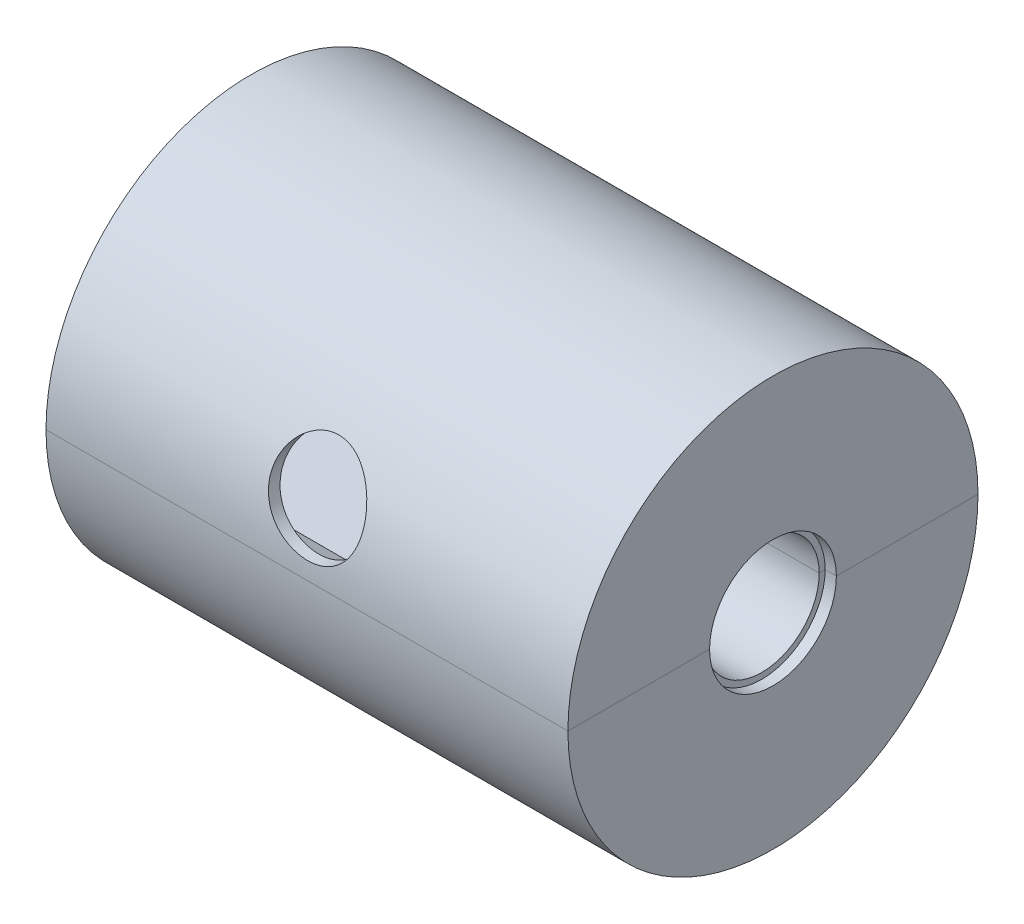
from build123d import *

# Parameters (mm, degrees)
SKETCH1_R           = 27.5
BOSS_EXTRUDE1_DEPTH = 70
SHELL1_T            = -1.5
SHELL2_T            = -1.5
SKETCH2_R           = 8.5
CUT_EXTRUDE1_DEPTH  = 81.07808689
BOSS_EXTRUDE2_DEPTH = 10
SKETCH5_W           = 45
SKETCH5_H           = 45
BOSS_EXTRUDE3_DEPTH = 1.6
MIRROR6_START       = -68.5
MIRROR6_DEPTH       = 10
MIRROR6_START_2     = -11.5
MIRROR6_2_DEPTH     = 10
SKETCH6_R           = 2
CUT_EXTRUDE2_DEPTH  = 8
SKETCH7_R           = 3
CUT_EXTRUDE3_DEPTH  = 81.07808689
SKETCH8_R           = 3
SKETCH8_R_2         = 2.3
BOSS_EXTRUDE4_DEPTH = 3
SKETCH9_R           = 6.25
CUT_EXTRUDE4_DEPTH  = 81.078087046


with BuildPart() as part:
    # Sketch1 → Boss-Extrude1 (new body)
    with BuildSketch(Plane(origin=(0, 0, 0), x_dir=(0, 0, -1), z_dir=(1, 0, 0))):
        Circle(SKETCH1_R)
    extrude(amount=-BOSS_EXTRUDE1_DEPTH)


with BuildPart() as body_2:
    # Split1: the piece on the far side of the plane
    add(part.part)
    split(bisect_by=Plane.ZX, keep=Keep.BOTTOM)

    # Shell1
    shell1_openings = [body_2.faces().sort_by_distance(p)[0] for p in [
        (-35, 0, 0),
    ]]
    offset(amount=SHELL1_T, openings=shell1_openings)


with BuildPart() as part_1:
    add(part.part)

    # Split1
    split(bisect_by=Plane.ZX, keep=Keep.TOP)

    # Shell2
    shell2_openings = [part_1.faces().sort_by_distance(p)[0] for p in [
        (-35, 0, 0),
    ]]
    offset(amount=SHELL2_T, openings=shell2_openings)


with BuildPart() as cut_extrude1_tool:
    # Sketch2 → Cut-Extrude1 (new, through all)
    with BuildSketch(Plane.ZY.offset(70)):
        Circle(SKETCH2_R)
    extrude(amount=-CUT_EXTRUDE1_DEPTH)


with BuildPart() as part_2:
    add(part_1.part)

    # Cut-Extrude1: cut by cut_extrude1_tool
    add(cut_extrude1_tool.part, mode=Mode.SUBTRACT)

    # Mirror6: read off the stored shape, not the designer's step
    # Mirror6 outline → Mirror6 (add)
    with BuildSketch(Plane.YZ.offset(MIRROR6_START)):
        with BuildLine():
            Line((0, -7.7), (0, -26))
            ThreePointArc((0, -26), (26, 0), (0, 26))
            Line((0, 26), (0, 7.7))
            ThreePointArc((0, 7.7), (7.7, 0), (0, -7.7))
        make_face()
    extrude(amount=MIRROR6_DEPTH)

    # Mirror6 2 outline → Mirror6 2 (add)
    with BuildSketch(Plane.YZ.offset(MIRROR6_START_2)):
        with BuildLine():
            Line((0, -7.7), (0, -26))
            ThreePointArc((0, -26), (26, 0), (0, 26))
            Line((0, 26), (0, 7.7))
            ThreePointArc((0, 7.7), (7.7, 0), (0, -7.7))
        make_face()
    extrude(amount=MIRROR6_2_DEPTH)

    # Sketch6 → Cut-Extrude2 (cut)
    with BuildSketch(Plane(origin=(0, 0, 0), x_dir=(1, 0, 0), z_dir=(0, 1, 0))):
        with Locations(Location((-63.5, 15.436211609, 0), (0, 0, 270))):
            Circle(SKETCH6_R)
        with Locations(Location((-6.5, 15.436211609, 0), (0, 0, 90))):
            Circle(SKETCH6_R)
        with Locations(Location((-63.5, -15.436211609, 0), (0, 0, 90))):
            Circle(SKETCH6_R)
        with Locations(Location((-6.5, -15.436211609, 0), (0, 0, 270))):
            Circle(SKETCH6_R)
    extrude(amount=CUT_EXTRUDE2_DEPTH, mode=Mode.SUBTRACT)

    # Sketch9 → Cut-Extrude4 (cut, through all)
    with BuildSketch(Plane.XY):
        with Locations(Location((-35, 8.5, 0), (0, 0, 180))):
            Circle(SKETCH9_R)
    extrude(amount=CUT_EXTRUDE4_DEPTH, mode=Mode.SUBTRACT)


with BuildPart() as body_2_1:
    add(body_2.part)

    # Cut-Extrude1: cut by cut_extrude1_tool
    add(cut_extrude1_tool.part, mode=Mode.SUBTRACT)


with BuildPart() as body_3:
    # Sketch4 → Boss-Extrude2 (new body)
    with BuildSketch(Plane(origin=(-68.5, 0, 0), x_dir=(0, 0, -1), z_dir=(1, 0, 0))):
        with BuildLine():
            Line((-26, 0), (-7.7, 0))
            ThreePointArc((-7.7, 0), (0, -7.7), (7.7, 0))
            Line((7.7, 0), (26, 0))
            ThreePointArc((26, 0), (0, -26), (-26, 0))
        make_face()
    extrude(amount=BOSS_EXTRUDE2_DEPTH)


with BuildPart() as body_4:
    # Sketch5 → Boss-Extrude3 (new body)
    with BuildSketch(Plane(origin=(0, 0, 0), x_dir=(1, 0, 0), z_dir=(0, 1, 0))):
        with Locations((-34.817558458, 0)):
            Rectangle(SKETCH5_W, SKETCH5_H)
    extrude(amount=-BOSS_EXTRUDE3_DEPTH)


with BuildPart() as body_5:
    # Mirror4: mirrored copy
    add(body_3.part.mirror(Plane.ZY.offset(35)))


with BuildPart() as body_2_2:
    add(body_2_1.part)

    # Combine1: read off the stored shape, not the designer's step
    # Combine1: union body 3, body 5
    add(body_3.part)
    add(body_5.part)

    # Sketch7 → Cut-Extrude3 (cut, through all)
    with BuildSketch(Plane(origin=(0, 0, 0), x_dir=(1, 0, 0), z_dir=(0, 1, 0))):
        with Locations(Location((-63.5, 15.436211609, 0), (0, 0, 270))):
            Circle(SKETCH7_R)
        with Locations(Location((-6.5, 15.436211609, 0), (0, 0, 270))):
            Circle(SKETCH7_R)
        with Locations(Location((-6.5, -15.436211609, 0), (0, 0, 270))):
            Circle(SKETCH7_R)
        with Locations(Location((-63.5, -15.436211609, 0), (0, 0, 270))):
            Circle(SKETCH7_R)
    extrude(amount=-CUT_EXTRUDE3_DEPTH, mode=Mode.SUBTRACT)

    # Sketch8 → Boss-Extrude4 (add)
    # profile 1 of 4: a face of its own
    with BuildSketch(Plane(origin=(0, 0, 0), x_dir=(1, 0, 0), z_dir=(0, 1, 0))):
        with Locations(Location((-63.5, -15.436211609, 0), (0, 0, 270))):
            Circle(SKETCH8_R)
        with Locations(Location((-63.5, -15.436211609, 0), (0, 0, 270))):
            Circle(SKETCH8_R_2, mode=Mode.SUBTRACT)
    # profile 2 of 4: a face of its own
    with BuildSketch(Plane(origin=(0, 0, 0), x_dir=(1, 0, 0), z_dir=(0, 1, 0))):
        with Locations(Location((-6.5, -15.436211609, 0), (0, 0, 270))):
            Circle(SKETCH8_R)
        with Locations(Location((-6.5, -15.436211609, 0), (0, 0, 270))):
            Circle(SKETCH8_R_2, mode=Mode.SUBTRACT)
    # profile 3 of 4: a face of its own
    with BuildSketch(Plane(origin=(0, 0, 0), x_dir=(1, 0, 0), z_dir=(0, 1, 0))):
        with Locations(Location((-6.5, 15.436211609, 0), (0, 0, 270))):
            Circle(SKETCH8_R)
        with Locations(Location((-6.5, 15.436211609, 0), (0, 0, 270))):
            Circle(SKETCH8_R_2, mode=Mode.SUBTRACT)
    # profile 4 of 4: a face of its own
    with BuildSketch(Plane(origin=(0, 0, 0), x_dir=(1, 0, 0), z_dir=(0, 1, 0))):
        with Locations(Location((-63.5, 15.436211609, 0), (0, 0, 270))):
            Circle(SKETCH8_R)
        with Locations(Location((-63.5, 15.436211609, 0), (0, 0, 270))):
            Circle(SKETCH8_R_2, mode=Mode.SUBTRACT)
    extrude(amount=-BOSS_EXTRUDE4_DEPTH)


solid = Compound([part_2.part, body_4.part, body_2_2.part])
